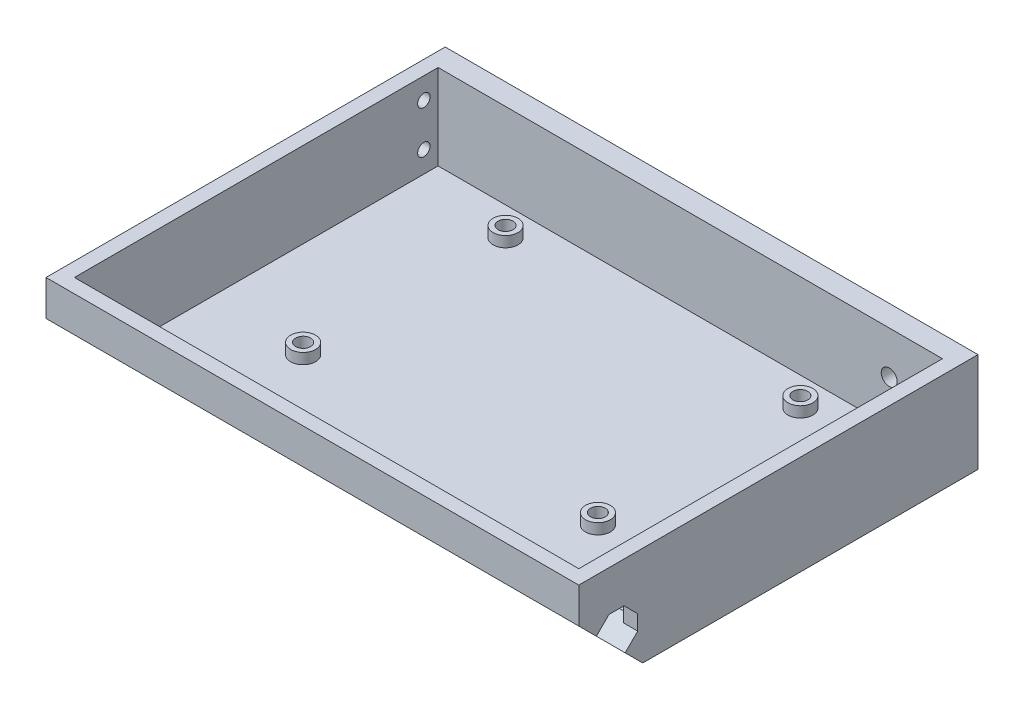
from build123d import *

# Parameters (mm, degrees)
BOSS_EXTRUDE1_DEPTH      = 120
BOSS_EXTRUDE1_DEPTH_BACK = 30
SKETCH1_W                = 28
SKETCH1_H                = 28
CHAMFER1_SIZE            = 18
SKETCH2_W                = 150
SKETCH2_H                = 28
BOSS_EXTRUDE2_DEPTH      = 100
SKETCH3_W                = 142
SKETCH3_H                = 100
CUT_EXTRUDE1_DEPTH       = 24
SKETCH4_W                = 142
SKETCH4_H                = 20
CUT_EXTRUDE2_DEPTH       = 4
CHAMFER2_SIZE            = 20
SKETCH6_R                = 1.75
CUT_EXTRUDE3_DEPTH       = 171.064693573
SKETCH10_W               = 165.029573665
SKETCH10_H               = 25.818236019
CUT_EXTRUDE7_DEPTH       = 168.868996542
CUT_EXTRUDE8_DEPTH       = 180.931301028
CHAMFER3_SIZE            = 3
SKETCH12_W               = 142
SKETCH12_H               = 11.455844122
CUT_EXTRUDE9_DEPTH       = 160.52775952
SKETCH13_W               = 142
SKETCH13_H               = 6
BOSS_EXTRUDE4_DEPTH      = 24
SKETCH14_R               = 2.25
CUT_EXTRUDE10_DEPTH      = 6
SKETCH15_R               = 1.75
CUT_EXTRUDE11_DEPTH      = 177.610512398
SKETCH17_R               = 3.5
BOSS_EXTRUDE5_DEPTH      = 3
SKETCH18_R               = 2.1
CUT_EXTRUDE12_DEPTH      = 6


with BuildPart() as part:
    # Sketch1 → Boss-Extrude1 (new, two sides: drawn at the far end of the back side and taken through both)
    with BuildSketch(Plane(origin=(0, 0, 0), x_dir=(0, 0, -1), z_dir=(1, 0, 0)).offset(-BOSS_EXTRUDE1_DEPTH_BACK)):
        Rectangle(SKETCH1_W, SKETCH1_H)
    extrude(amount=BOSS_EXTRUDE1_DEPTH + BOSS_EXTRUDE1_DEPTH_BACK)

    # Chamfer1
    chamfer1_edges = [part.edges().sort_by_distance(p)[0] for p in [
        (45, -14, 14),
    ]]
    chamfer(chamfer1_edges, length=CHAMFER1_SIZE)

    # Sketch2 → Boss-Extrude2 (add)
    with BuildSketch(Plane(origin=(0, 0, -14), x_dir=(-1, 0, 0), z_dir=(0, 0, -1))):
        with Locations((-45, 0)):
            Rectangle(SKETCH2_W, SKETCH2_H)
    extrude(amount=BOSS_EXTRUDE2_DEPTH)

    # Sketch3 → Cut-Extrude1 (cut)
    with BuildSketch(Plane(origin=(0, 14, 0), x_dir=(1, 0, 0), z_dir=(0, 1, 0))):
        with Locations((45, 60)):
            Rectangle(SKETCH3_W, SKETCH3_H)
    extrude(amount=-CUT_EXTRUDE1_DEPTH, mode=Mode.SUBTRACT)

    # Sketch4 → Cut-Extrude2 (cut)
    with BuildSketch(Plane(origin=(0, 14, 0), x_dir=(1, 0, 0), z_dir=(0, 1, 0))):
        with Locations((45, 0)):
            Rectangle(SKETCH4_W, SKETCH4_H)
    extrude(amount=-CUT_EXTRUDE2_DEPTH, mode=Mode.SUBTRACT)

    # Chamfer2
    chamfer2_edges = [part.edges().sort_by_distance(p)[0] for p in [
        (45, 10, -10),
    ]]
    chamfer(chamfer2_edges, length=CHAMFER2_SIZE - 0.0001)  # a hair under: the kernel refuses the full size

    # Sketch6 → Cut-Extrude3 (cut, through all)
    with BuildSketch(Plane(origin=(0, -5, 5), x_dir=(1, 0, 0), z_dir=(0, -0.7071067811865465, 0.7071067811865487))):
        with Locations(Location((34, 10, 0), (0, 0, 270))):
            Circle(SKETCH6_R)
        with Locations(Location((17.996557672, 10, 0), (0, 0, 270))):
            Circle(SKETCH6_R)
        with Locations(Location((56, 10, 0), (0, 0, 270))):
            Circle(SKETCH6_R)
        with Locations(Location((72, 10, 0), (0, 0, 270))):
            Circle(SKETCH6_R)
        with Locations(Location((72, -10, 0), (0, 0, 270))):
            Circle(SKETCH6_R)
        with Locations(Location((56, -10, 0), (0, 0, 270))):
            Circle(SKETCH6_R)
        with Locations(Location((34, -10, 0), (0, 0, 270))):
            Circle(SKETCH6_R)
        with Locations(Location((17.996557672, -10, 0), (0, 0, 270))):
            Circle(SKETCH6_R)
    extrude(amount=-CUT_EXTRUDE3_DEPTH, mode=Mode.SUBTRACT)

    # Sketch10 → Cut-Extrude7 (cut, through all)
    with BuildSketch(Plane(origin=(0, 14, 0), x_dir=(1, 0, 0), z_dir=(0, 1, 0))):
        with Locations((52.514786833, 111.292414811)):
            Rectangle(SKETCH10_W, SKETCH10_H)
    extrude(amount=-CUT_EXTRUDE7_DEPTH, mode=Mode.SUBTRACT)

    # Sketch11 → Cut-Extrude8 (cut, through all)
    with BuildSketch(Plane.ZY.offset(30)):
        Polygon((9.050252532, -0.949747468), (3.393398282, 4.707106781), (-4.707106781, -3.393398282), (0.949747468, -9.050252532), align=None)
    extrude(amount=-CUT_EXTRUDE8_DEPTH, mode=Mode.SUBTRACT)

    # Chamfer3
    chamfer3_edges = [part.edges().sort_by_distance(p)[0] for p in [
        (-28, 4.707106781, 3.393398282),
        (-28, -3.393398282, -4.707106781),
    ]]
    chamfer(chamfer3_edges, length=CHAMFER3_SIZE)

    # Sketch12 → Cut-Extrude9 (cut, through all)
    with BuildSketch(Plane(origin=(0, -5, 5), x_dir=(-1, 0, 0), z_dir=(0, -0.7071067811865513, 0.7071067811865437))):
        with Locations((-45, 0)):
            Rectangle(SKETCH12_W, SKETCH12_H)
    extrude(amount=-CUT_EXTRUDE9_DEPTH, mode=Mode.SUBTRACT)

    # Sketch13 → Boss-Extrude4 (add)
    with BuildSketch(Plane(origin=(0, -10, 0), x_dir=(1, 0, 0), z_dir=(0, 1, 0))):
        with Locations((45, 95.383296801)):
            Rectangle(SKETCH13_W, SKETCH13_H)
    extrude(amount=BOSS_EXTRUDE4_DEPTH)

    # Sketch14 → Cut-Extrude10 (cut)
    with BuildSketch(Plane(origin=(0, 0, -98.383296801), x_dir=(-1, 0, 0), z_dir=(0, 0, -1))):
        with Locations((-101, 2)):
            Circle(SKETCH14_R)
    extrude(amount=-CUT_EXTRUDE10_DEPTH, mode=Mode.SUBTRACT)

    # Sketch15 → Cut-Extrude11 (cut, through all)
    with BuildSketch(Plane(origin=(-26, 0, 0), x_dir=(0, 0, -1), z_dir=(1, 0, 0))):
        with Locations((88.383296801, 8)):
            Circle(SKETCH15_R)
        with Locations((88.383296801, -4)):
            Circle(SKETCH15_R)
    extrude(amount=-CUT_EXTRUDE11_DEPTH, mode=Mode.SUBTRACT)

    # Sketch17 → Boss-Extrude5 (add)
    with BuildSketch(Plane(origin=(0, -10, 0), x_dir=(1, 0, 0), z_dir=(0, 1, 0))):
        with Locations(Location((1, 84.383296801, 0), (0, 0, 270))):
            Circle(SKETCH17_R)
        with Locations(Location((84, 84.383296801, 0), (0, 0, 270))):
            Circle(SKETCH17_R)
        with Locations(Location((84, 27.383296801, 0), (0, 0, 270))):
            Circle(SKETCH17_R)
        with Locations(Location((1, 27.383296801, 0), (0, 0, 270))):
            Circle(SKETCH17_R)
    extrude(amount=BOSS_EXTRUDE5_DEPTH)

    # Sketch18 → Cut-Extrude12 (cut)
    with BuildSketch(Plane(origin=(0, -7, 0), x_dir=(1, 0, 0), z_dir=(0, 1, 0))):
        with Locations(Location((84, 84.383296801, 0), (0, 0, 270))):
            Circle(SKETCH18_R)
        with Locations(Location((84, 27.383296801, 0), (0, 0, 270))):
            Circle(SKETCH18_R)
        with Locations(Location((1, 27.383296801, 0), (0, 0, 270))):
            Circle(SKETCH18_R)
        with Locations(Location((1, 84.383296801, 0), (0, 0, 270))):
            Circle(SKETCH18_R)
    extrude(amount=-CUT_EXTRUDE12_DEPTH, mode=Mode.SUBTRACT)


solid = part.part
